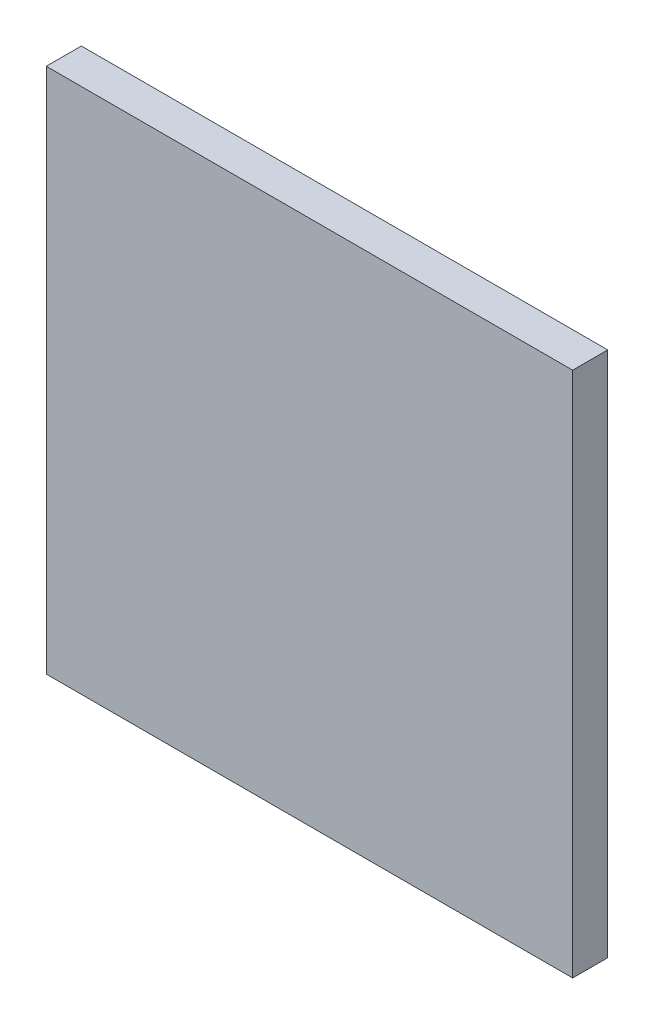
from build123d import *

# Parameters (mm, degrees)
IZIM1_W            = 300
IZIM1_H            = 300
TABAN_FLAN_1_DEPTH = 20


# Sheet-metal steps are written as plain solids
with BuildPart() as part:
    # Çizim1 → Taban-Flanş1 (new body)
    with BuildSketch(Plane.XY):
        with Locations((150, -150)):
            Rectangle(IZIM1_W, IZIM1_H)
    extrude(amount=-TABAN_FLAN_1_DEPTH)


solid = part.part
